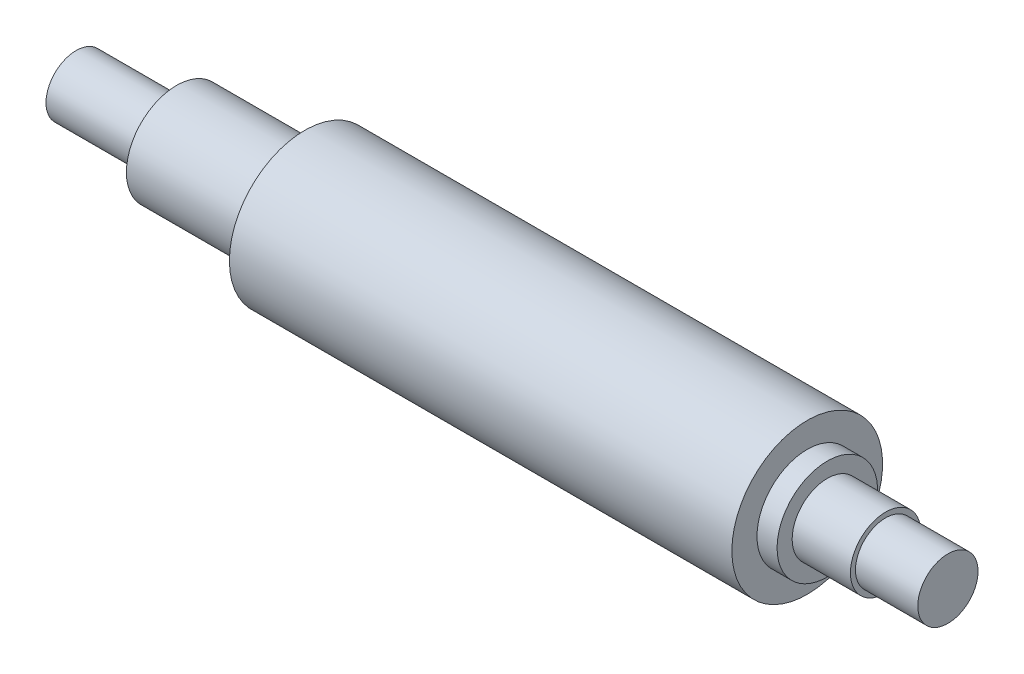
from build123d import *


with BuildPart() as part:
    # Sketch3 → Revolve2 (revolve)
    with BuildSketch(Plane.XY):
        Polygon((-43.375, 0), (43.375, 0), (43.375, 3), (37.175, 3), (37.175, 3.5), (31.375, 3.5), (31.375, 5), (29.375, 5), (29.375, 7.5), (-20.625, 7.5), (-20.625, 5), (-33.375, 5), (-33.375, 3), (-43.375, 3), align=None)
    revolve(axis=Axis((-43.375, 0, 0), (1, 0, 0)))


solid = part.part
